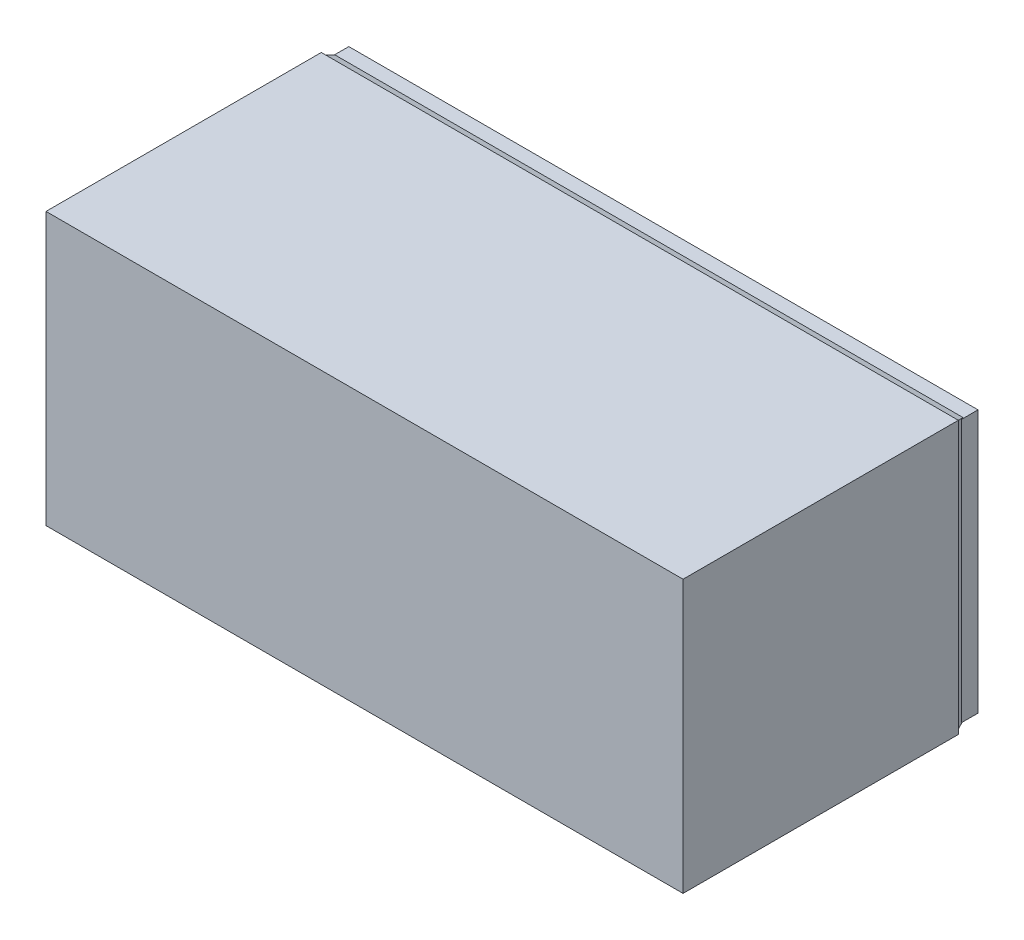
from build123d import *
from OCP.BRepFilletAPI import BRepFilletAPI_MakeChamfer

# Parameters (mm, degrees)
SKETCH_1_W          = 405
SKETCH_1_H          = 173
EXTRUDE_1_DEPTH     = 190
SKETCH_2_W          = 405
SKETCH_2_H          = 173
SKETCH_2_W_2        = 400
SKETCH_2_H_2        = 167
CUT_EXTRUDE_1_DEPTH = 9
SKETCH_3_W          = 405
SKETCH_3_H          = 6
CUT_EXTRUDE_2_DEPTH = 1
SKETCH_4_W          = 6
SKETCH_4_H          = 173
CUT_EXTRUDE_3_DEPTH = 1
SKETCH_5_W          = 404
SKETCH_5_H          = 6
CUT_EXTRUDE_4_DEPTH = 1
SKETCH_6_W          = 6
SKETCH_6_H          = 171
CUT_EXTRUDE_5_DEPTH = 1
CHAMFER_1_SIZE      = 6
CHAMFER_1_SIZE_2    = 2
CHAMFER_2_SIZE      = 2
CHAMFER_2_SIZE_2    = 6
SKETCH_7_W          = 64.686
SKETCH_7_H          = 163.6
SKETCH_7_W_2        = 64.682
CUT_EXTRUDE_6_DEPTH = 183


# Some blends are built 0.0001 mm under size
with BuildPart() as part:
    # 草图1 → 凸台-拉伸1 (new body)
    with BuildSketch(Plane.XY):
        with Locations((202.5, 86.5)):
            Rectangle(SKETCH_1_W, SKETCH_1_H)
    extrude(amount=EXTRUDE_1_DEPTH)

    # 草图2 → 切除-拉伸1 (cut)
    with BuildSketch(Plane(origin=(0, 0, 0), x_dir=(-1, 0, 0), z_dir=(0, 0, -1))):
        with Locations((-202.5, 86.5)):
            Rectangle(SKETCH_2_W, SKETCH_2_H)
        with Locations((-202.5, 86.5)):
            Rectangle(SKETCH_2_W_2, SKETCH_2_H_2, mode=Mode.SUBTRACT)
    extrude(amount=-CUT_EXTRUDE_1_DEPTH, mode=Mode.SUBTRACT)

    # 草图3 → 切除-拉伸2 (cut)
    with BuildSketch(Plane.XZ):
        with Locations((202.5, 12)):
            Rectangle(SKETCH_3_W, SKETCH_3_H)
    extrude(amount=-CUT_EXTRUDE_2_DEPTH, mode=Mode.SUBTRACT)

    # 草图4 → 切除-拉伸3 (cut)
    with BuildSketch(Plane(origin=(405, 0, 0), x_dir=(0, 0, -1), z_dir=(1, 0, 0))):
        with Locations((-12, 86.5)):
            Rectangle(SKETCH_4_W, SKETCH_4_H)
    extrude(amount=-CUT_EXTRUDE_3_DEPTH, mode=Mode.SUBTRACT)

    # 草图5 → 切除-拉伸4 (cut)
    with BuildSketch(Plane(origin=(0, 173, 0), x_dir=(1, 0, 0), z_dir=(0, 1, 0))):
        with Locations((202, -12)):
            Rectangle(SKETCH_5_W, SKETCH_5_H)
    extrude(amount=-CUT_EXTRUDE_4_DEPTH, mode=Mode.SUBTRACT)

    # 草图6 → 切除-拉伸5 (cut)
    with BuildSketch(Plane.ZY):
        with Locations((12, 86.5)):
            Rectangle(SKETCH_6_W, SKETCH_6_H)
    extrude(amount=-CUT_EXTRUDE_5_DEPTH, mode=Mode.SUBTRACT)

    # 倒角1
    # the kernel refuses this chamfer: 6, 2 mm, written as the material it takes off along each edge
    with BuildSketch(Plane(origin=(1, -14.570366064, 9), x_dir=(-0.012185754582199162, 0, 0.9999257509361694), z_dir=(0, 1, 0))) as chamfer_1_piece_1_section:
        Polygon((CHAMFER_1_SIZE * 0.999925750936, CHAMFER_1_SIZE * 0.0121857545822), (-CHAMFER_1_SIZE_2 * 0.0121857545822, CHAMFER_1_SIZE_2 * 0.999925750936), (0, 0), align=None)
    chamfer_1_piece_1 = extrude(amount=202.140732128, mode=Mode.PRIVATE)
    chamfer_1_piece_1 = split(chamfer_1_piece_1, bisect_by=Plane(origin=(2.5, 2, 11.1), z_dir=(-1, 0, 0)), keep=Keep.TOP, mode=Mode.PRIVATE)
    add(chamfer_1_piece_1, mode=Mode.SUBTRACT)
    with BuildSketch(Plane(origin=(1, -14.570366064, 9), x_dir=(-0.012185754582199162, 0, 0.9999257509361694), z_dir=(0, 1, 0))) as chamfer_1_piece_2_section:
        Polygon((CHAMFER_1_SIZE * 0.999925750936, CHAMFER_1_SIZE * 0.0121857545822), (-CHAMFER_1_SIZE_2 * 0.0121857545822, CHAMFER_1_SIZE_2 * 0.999925750936), (0, 0), align=None)
    chamfer_1_piece_2 = extrude(amount=202.140732128, mode=Mode.PRIVATE)
    chamfer_1_piece_2 = split(chamfer_1_piece_2, bisect_by=Plane(origin=(2.666666667, 3, 9.5), z_dir=(0, -1, 0)), keep=Keep.TOP, mode=Mode.PRIVATE)
    add(chamfer_1_piece_2, mode=Mode.SUBTRACT)
    with BuildSketch(Plane(origin=(1, -14.570366064, 9), x_dir=(-0.012185754582199162, 0, 0.9999257509361694), z_dir=(0, 1, 0))) as chamfer_1_piece_3_section:
        Polygon((CHAMFER_1_SIZE * 0.999925750936, CHAMFER_1_SIZE * 0.0121857545822), (-CHAMFER_1_SIZE_2 * 0.0121857545822, CHAMFER_1_SIZE_2 * 0.999925750936), (0, 0), align=None)
    chamfer_1_piece_3 = extrude(amount=202.140732128, mode=Mode.PRIVATE)
    chamfer_1_piece_3 = split(chamfer_1_piece_3, bisect_by=Plane(origin=(2.666666667, 170, 9.5), z_dir=(0, 1, 0)), keep=Keep.TOP, mode=Mode.PRIVATE)
    add(chamfer_1_piece_3, mode=Mode.SUBTRACT)
    with BuildSketch(Plane(origin=(404, -14.570366064, 9), x_dir=(-0.9940388851139268, 0, -0.10902612017980623), z_dir=(0, 1, 0))) as chamfer_1_piece_4_section:
        Polygon((CHAMFER_1_SIZE_2 * 0.994038885114, CHAMFER_1_SIZE_2 * 0.10902612018), (-CHAMFER_1_SIZE * 0.10902612018, CHAMFER_1_SIZE * 0.994038885114), (0, 0), align=None)
    chamfer_1_piece_4 = extrude(amount=202.140732128, mode=Mode.PRIVATE)
    chamfer_1_piece_4 = split(chamfer_1_piece_4, bisect_by=Plane(origin=(402.333333333, 3, 9.5), z_dir=(0, -1, 0)), keep=Keep.TOP, mode=Mode.PRIVATE)
    add(chamfer_1_piece_4, mode=Mode.SUBTRACT)
    with BuildSketch(Plane(origin=(404, -14.570366064, 9), x_dir=(-0.9940388851139268, 0, -0.10902612017980623), z_dir=(0, 1, 0))) as chamfer_1_piece_5_section:
        Polygon((CHAMFER_1_SIZE_2 * 0.994038885114, CHAMFER_1_SIZE_2 * 0.10902612018), (-CHAMFER_1_SIZE * 0.10902612018, CHAMFER_1_SIZE * 0.994038885114), (0, 0), align=None)
    chamfer_1_piece_5 = extrude(amount=202.140732128, mode=Mode.PRIVATE)
    chamfer_1_piece_5 = split(chamfer_1_piece_5, bisect_by=Plane(origin=(402.5, 86.5, 11.1), z_dir=(1, 0, 0)), keep=Keep.TOP, mode=Mode.PRIVATE)
    add(chamfer_1_piece_5, mode=Mode.SUBTRACT)
    with BuildSketch(Plane(origin=(404, -14.570366064, 9), x_dir=(-0.9940388851139268, 0, -0.10902612017980623), z_dir=(0, 1, 0))) as chamfer_1_piece_6_section:
        Polygon((CHAMFER_1_SIZE_2 * 0.994038885114, CHAMFER_1_SIZE_2 * 0.10902612018), (-CHAMFER_1_SIZE * 0.10902612018, CHAMFER_1_SIZE * 0.994038885114), (0, 0), align=None)
    chamfer_1_piece_6 = extrude(amount=202.140732128, mode=Mode.PRIVATE)
    chamfer_1_piece_6 = split(chamfer_1_piece_6, bisect_by=Plane(origin=(402.333333333, 170, 9.5), z_dir=(0, 1, 0)), keep=Keep.TOP, mode=Mode.PRIVATE)
    add(chamfer_1_piece_6, mode=Mode.SUBTRACT)

    # 倒角2
    chamfer_2_edges_1 = [part.edges().sort_by_distance(p)[0] for p in [
        (202.5, 172, 9),
    ]]
    chamfer_2_side_1 = [part.faces().sort_by_distance(p)[0] for p in [
        (202.5, 171.96, 9),
    ]]
    chamfer_2_edges_2 = [part.edges().sort_by_distance(p)[0] for p in [
        (202.5, 1, 9),
    ]]
    chamfer_2_side_2 = [part.faces().sort_by_distance(p)[0] for p in [
        (202.5, 1.04, 9),
    ]]
    chamfer_2 = BRepFilletAPI_MakeChamfer(part.part.solid().wrapped)
    for e in chamfer_2_edges_1:
        chamfer_2.Add(CHAMFER_2_SIZE - 0.0001, CHAMFER_2_SIZE_2 - 0.0001, e.wrapped, chamfer_2_side_1[0].wrapped)
    for e in chamfer_2_edges_2:
        chamfer_2.Add(CHAMFER_2_SIZE - 0.0001, CHAMFER_2_SIZE_2 - 0.0001, e.wrapped, chamfer_2_side_2[0].wrapped)
    add(Compound.cast(chamfer_2.Shape()), mode=Mode.REPLACE)  # a hair under: the kernel refuses the full size

    # 草图7 → 切除-拉伸6 (cut)
    with BuildSketch(Plane(origin=(0, 0, 0), x_dir=(-1, 0, 0), z_dir=(0, 0, -1))):
        with Locations((-235.693, 86.5)):
            Rectangle(SKETCH_7_W, SKETCH_7_H)
        with Locations((-169.307, 86.5)):
            Rectangle(SKETCH_7_W, SKETCH_7_H)
        with Locations((-102.923, 86.5)):
            Rectangle(SKETCH_7_W_2, SKETCH_7_H)
        with Locations((-36.541, 86.5)):
            Rectangle(SKETCH_7_W_2, SKETCH_7_H)
        with Locations((-302.077, 86.5)):
            Rectangle(SKETCH_7_W_2, SKETCH_7_H)
        with Locations((-368.459, 86.5)):
            Rectangle(SKETCH_7_W_2, SKETCH_7_H)
    extrude(amount=-CUT_EXTRUDE_6_DEPTH, mode=Mode.SUBTRACT)


solid = part.part
